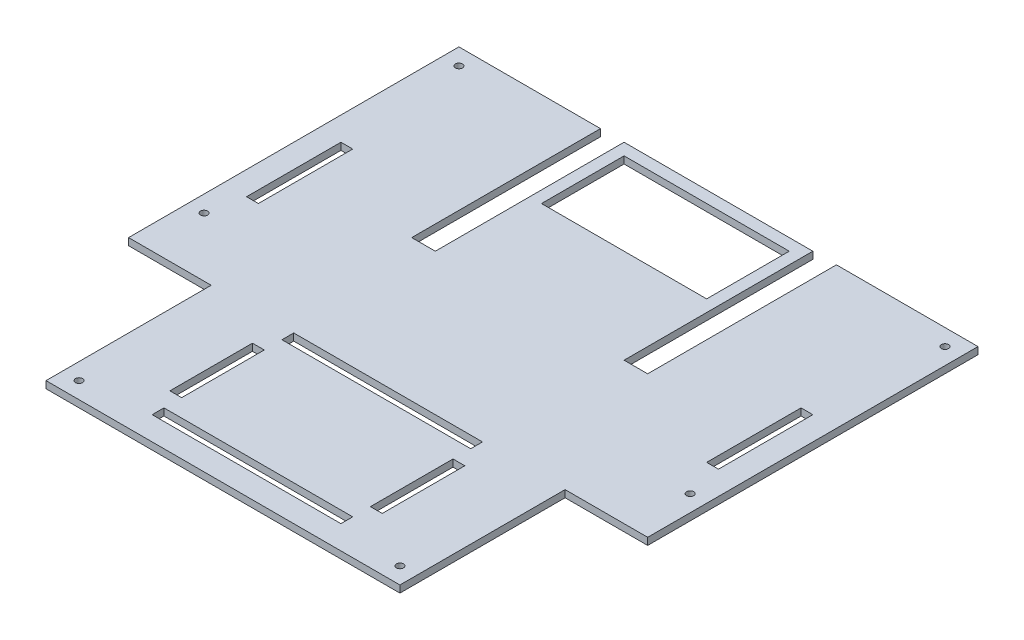
from build123d import *

# Parameters (mm, degrees)
SKETCH4_W           = 220
SKETCH4_H           = 210
BOSS_EXTRUDE1_DEPTH = 3
SKETCH5_W           = 35
SKETCH5_H           = 70
CUT_EXTRUDE1_DEPTH  = 3
SKETCH6_W           = 35
SKETCH6_H           = 70
CUT_EXTRUDE2_DEPTH  = 3
SKETCH22_R          = 1.5
CUT_EXTRUDE15_DEPTH = 3
SKETCH26_R          = 1.5
CUT_EXTRUDE16_DEPTH = 3
SKETCH24_R          = 1.5
CUT_EXTRUDE17_DEPTH = 3
SKETCH25_R          = 1.5
CUT_EXTRUDE18_DEPTH = 3
SKETCH27_R          = 1.5
CUT_EXTRUDE19_DEPTH = 3
SKETCH28_R          = 1.5
CUT_EXTRUDE20_DEPTH = 3
SKETCH56_W          = 10
SKETCH56_H          = 80
SKETCH56_W_2        = 70
SKETCH56_H_2        = 35
CUT_EXTRUDE21_DEPTH = 3
SKETCH57_W          = 80
SKETCH57_H          = 5
SKETCH57_W_2        = 5
SKETCH57_H_2        = 35
SKETCH57_H_3        = 40
CUT_EXTRUDE22_DEPTH = 3


with BuildPart() as part:
    # Sketch4 → Boss-Extrude1 (new body)
    with BuildSketch(Plane(origin=(0, 0, 0), x_dir=(1, 0, 0), z_dir=(0, 1, 0))):
        with Locations((-110, 105)):
            Rectangle(SKETCH4_W, SKETCH4_H)
    extrude(amount=BOSS_EXTRUDE1_DEPTH)

    # Sketch5 → Cut-Extrude1 (cut)
    with BuildSketch(Plane(origin=(0, 3, 0), x_dir=(1, 0, 0), z_dir=(0, 1, 0))):
        with Locations((-202.5, 35)):
            Rectangle(SKETCH5_W, SKETCH5_H)
    extrude(amount=-CUT_EXTRUDE1_DEPTH, mode=Mode.SUBTRACT)

    # Sketch6 → Cut-Extrude2 (cut)
    with BuildSketch(Plane(origin=(0, 3, 0), x_dir=(1, 0, 0), z_dir=(0, 1, 0))):
        with Locations((-17.5, 35)):
            Rectangle(SKETCH6_W, SKETCH6_H)
    extrude(amount=-CUT_EXTRUDE2_DEPTH, mode=Mode.SUBTRACT)

    # Sketch22 → Cut-Extrude15 (cut)
    with BuildSketch(Plane(origin=(0, 3, 0), x_dir=(1, 0, 0), z_dir=(0, 1, 0))):
        with Locations((-178, 7)):
            Circle(SKETCH22_R)
    extrude(amount=-CUT_EXTRUDE15_DEPTH, mode=Mode.SUBTRACT)

    # Sketch26 → Cut-Extrude16 (cut)
    with BuildSketch(Plane(origin=(0, 3, 0), x_dir=(1, 0, 0), z_dir=(0, 1, 0))):
        with Locations((-213, 203)):
            Circle(SKETCH26_R)
    extrude(amount=-CUT_EXTRUDE16_DEPTH, mode=Mode.SUBTRACT)

    # Sketch24 → Cut-Extrude17 (cut)
    with BuildSketch(Plane(origin=(0, 3, 0), x_dir=(1, 0, 0), z_dir=(0, 1, 0))):
        with Locations((-42, 7)):
            Circle(SKETCH24_R)
    extrude(amount=-CUT_EXTRUDE17_DEPTH, mode=Mode.SUBTRACT)

    # Sketch25 → Cut-Extrude18 (cut)
    with BuildSketch(Plane(origin=(0, 3, 0), x_dir=(1, 0, 0), z_dir=(0, 1, 0))):
        with Locations((-7, 203)):
            Circle(SKETCH25_R)
    extrude(amount=-CUT_EXTRUDE18_DEPTH, mode=Mode.SUBTRACT)

    # Sketch27 → Cut-Extrude19 (cut)
    with BuildSketch(Plane(origin=(0, 3, 0), x_dir=(1, 0, 0), z_dir=(0, 1, 0))):
        with Locations((-213, 95)):
            Circle(SKETCH27_R)
    extrude(amount=-CUT_EXTRUDE19_DEPTH, mode=Mode.SUBTRACT)

    # Sketch28 → Cut-Extrude20 (cut)
    with BuildSketch(Plane(origin=(0, 3, 0), x_dir=(1, 0, 0), z_dir=(0, 1, 0))):
        with Locations((-7, 95)):
            Circle(SKETCH28_R)
    extrude(amount=-CUT_EXTRUDE20_DEPTH, mode=Mode.SUBTRACT)

    # Sketch56 → Cut-Extrude21 (cut)
    with BuildSketch(Plane(origin=(0, 3, 0), x_dir=(1, 0, 0), z_dir=(0, 1, 0))):
        with Locations((-65, 170)):
            Rectangle(SKETCH56_W, SKETCH56_H)
        with Locations((-110, 187.5)):
            Rectangle(SKETCH56_W_2, SKETCH56_H_2)
        with Locations((-155, 170)):
            Rectangle(SKETCH56_W, SKETCH56_H)
    extrude(amount=-CUT_EXTRUDE21_DEPTH, mode=Mode.SUBTRACT)

    # Sketch57 → Cut-Extrude22 (cut)
    with BuildSketch(Plane(origin=(0, 3, 0), x_dir=(1, 0, 0), z_dir=(0, 1, 0))):
        with Locations((-110, 67.5)):
            Rectangle(SKETCH57_W, SKETCH57_H)
        with Locations((-110, 12.5)):
            Rectangle(SKETCH57_W, SKETCH57_H)
        with Locations((-67.5, 40)):
            Rectangle(SKETCH57_W_2, SKETCH57_H_2)
        with Locations((-152.5, 40)):
            Rectangle(SKETCH57_W_2, SKETCH57_H_2)
        with Locations((-12.5, 130)):
            Rectangle(SKETCH57_W_2, SKETCH57_H_3)
        with Locations((-207.5, 130)):
            Rectangle(SKETCH57_W_2, SKETCH57_H_3)
    extrude(amount=-CUT_EXTRUDE22_DEPTH, mode=Mode.SUBTRACT)


solid = part.part
